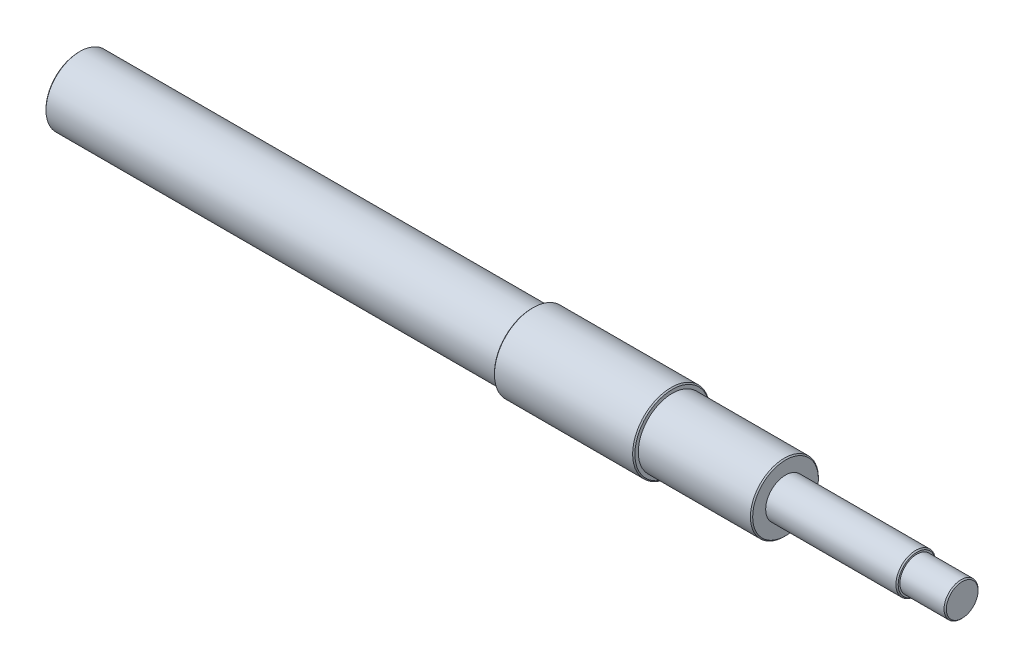
from build123d import *

# Parameters (mm, degrees)
CHAMFER1_SIZE = 0.1


with BuildPart() as part:
    # Sketch1 → Revolve1 (revolve)
    with BuildSketch(Plane.XY):
        Polygon((-25.6, 3), (-15.6, 3), (-15.6, 1.75), (-4, 1.75), (-4, 1.5), (0, 1.5), (0, 0), (-78, 0), (-78, 3), (-38, 3), (-38, 3.4), (-25.6, 3.4), align=None)
    revolve(axis=Axis((0, 0, 0), (1, 0, 0)))

    # Chamfer1
    chamfer1_edges = [part.edges().sort_by_distance(p)[0] for p in [
        (0, -1.5, 0),
        (-4, -1.75, 0),
        (-38, -3.4, 0),
        (-25.6, -3.4, 0),
        (-15.6, -3, 0),
        (-78, -3, 0),
    ]]
    chamfer(chamfer1_edges, length=CHAMFER1_SIZE)


solid = part.part
